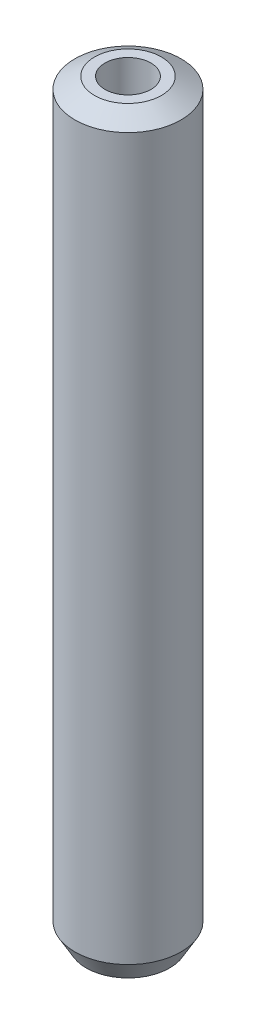
from build123d import *
from OCP.BRepFilletAPI import BRepFilletAPI_MakeChamfer

# Parameters (mm, degrees)
SKETCH1_R           = 15
BOSS_EXTRUDE1_DEPTH = 212.484828404
SKETCH2_R           = 6.489963069
CUT_EXTRUDE1_DEPTH  = 214.541102137
CHAMFER1_SIZE       = 3.205487909
CHAMFER1_SIZE2      = 5.552067922


with BuildPart() as part:
    # Sketch1 → Boss-Extrude1 (new body)
    with BuildSketch(Plane(origin=(0, 0, 0), x_dir=(1, 0, 0), z_dir=(0, 1, 0))):
        Circle(SKETCH1_R)
    extrude(amount=BOSS_EXTRUDE1_DEPTH)

    # Sketch2 → Cut-Extrude1 (cut, through all)
    with BuildSketch(Plane(origin=(0, 0, 0), x_dir=(1, 0, 0), z_dir=(0, 1, 0))):
        Circle(SKETCH2_R)
    extrude(amount=CUT_EXTRUDE1_DEPTH, mode=Mode.SUBTRACT)

    # Chamfer1: one chamfer whose edges measure the first distance from different faces: ONE call of the kernel's chamfer builder (chamfer() names one face for all edges)
    chamfer1_edges_1 = [part.edges().sort_by_distance(p)[0] for p in [
        (-15, 212.484828404, 0),
    ]]
    chamfer1_side_1 = [part.faces().sort_by_distance(p)[0] for p in [
        (-15, 106.242414202, 0),
    ]]
    chamfer1_edges_2 = [part.edges().sort_by_distance(p)[0] for p in [
        (-15, 0, 0),
    ]]
    chamfer1_side_2 = [part.faces().sort_by_distance(p)[0] for p in [
        (-14.575735931, 0, 0),
    ]]
    chamfer1 = BRepFilletAPI_MakeChamfer(part.part.solid().wrapped)
    for e in chamfer1_edges_1:
        chamfer1.Add(CHAMFER1_SIZE, CHAMFER1_SIZE2, e.wrapped, chamfer1_side_1[0].wrapped)  # the first distance lies on this face
    for e in chamfer1_edges_2:
        chamfer1.Add(CHAMFER1_SIZE, CHAMFER1_SIZE2, e.wrapped, chamfer1_side_2[0].wrapped)  # the first distance lies on this face
    add(Compound.cast(chamfer1.Shape()), mode=Mode.REPLACE)


solid = part.part
